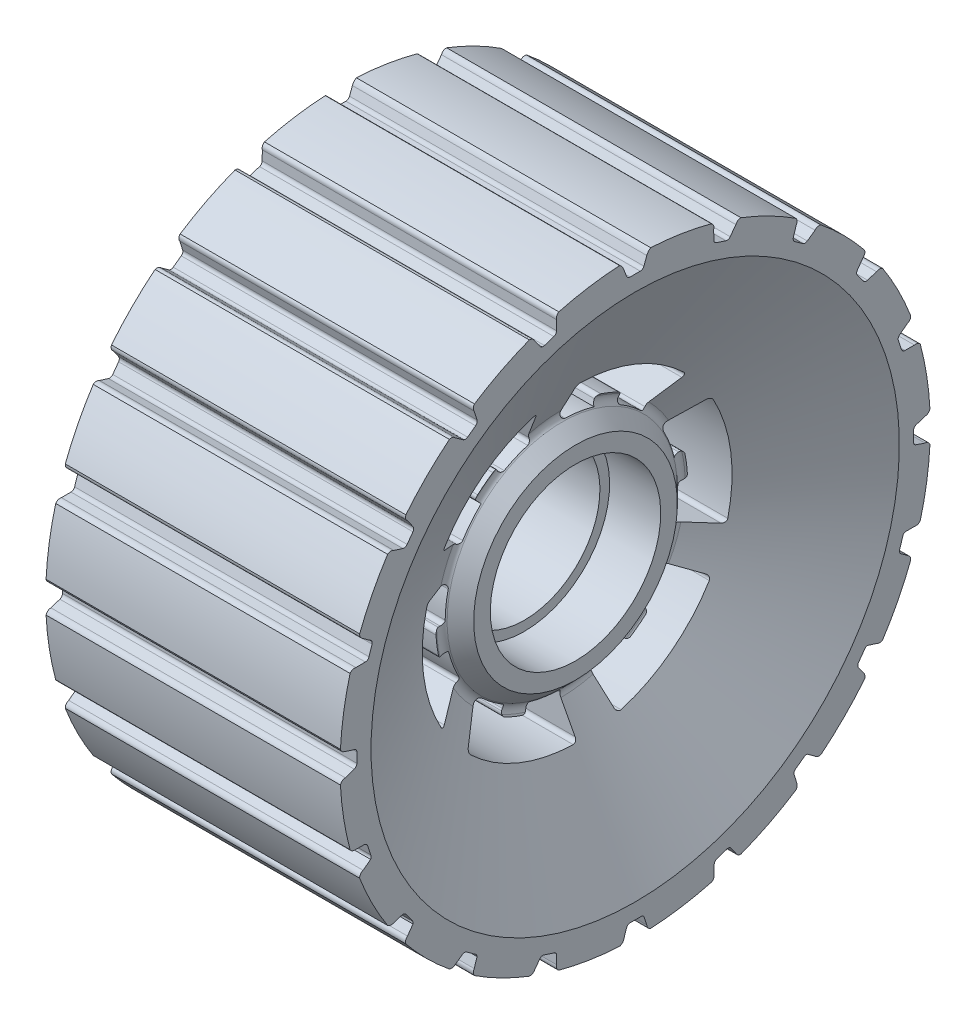
from build123d import *

# Parameters (mm, degrees)
CUT_EXTRUDE1_DEPTH = 25
FILLET2_R          = 0.5
CIRPATTERN1_START  = -11.507760495
CIRPATTERN1_DEPTH  = 23.015520709
FILLET3_R          = 0.5
CUT_EXTRUDE3_DEPTH = 66.933451355


# Read off the part's stored shape, not the designer's step: CirPattern1
with BuildPart() as part:
    # Sketch3 → revolveHub (revolve)
    with BuildSketch(Plane.XY, mode=Mode.PRIVATE) as revolvehub_sk:
        with BuildLine():
            Line((-11.3, 11), (-4.7, 11))
            Line((-4.7, 11), (-4.7, 9.75))
            Line((-4.7, 9.75), (4.7, 9.75))
            Line((4.7, 9.75), (4.7, 11))
            Line((4.7, 11), (11.3, 11))
            Line((11.3, 11), (11.3, 13.15))
            Line((11.3, 13.15), (9.581889198, 14.868110802))
            ThreePointArc((9.581889198, 14.868110802), (9.3, 15.427275186), (9.405922165, 16.04445168))
            Line((9.405922165, 16.04445168), (19, 34.1))
            Line((19, 34.1), (19, 38.1))
            Line((19, 38.1), (-19, 38.1))
            Line((-19, 38.1), (-19, 34.1))
            Line((-19, 34.1), (-9.405922165, 16.04445168))
            ThreePointArc((-9.405922165, 16.04445168), (-9.3, 15.427275186), (-9.581889198, 14.868110802))
            Line((-9.581889198, 14.868110802), (-11.3, 13.15))
            Line((-11.3, 13.15), (-11.3, 11))
        make_face()
    revolve(revolvehub_sk.sketch.rotate(Axis((0, 0, 0), (1, 0, 0)), 180), axis=Axis((0, 0, 0), (1, 0, 0)))

    # Sketch6 → Cut-Extrude1 (cut, symmetric)
    with BuildSketch(Plane(origin=(0, 0, 0), x_dir=(0, 0, -1), z_dir=(1, 0, 0))):
        with BuildLine():
            Line((0, 15), (0, 20))
            ThreePointArc((0, 20), (7.653668647, 18.47759065), (14.142135624, 14.142135624))
            Line((14.142135624, 14.142135624), (10.606601718, 10.606601718))
            ThreePointArc((10.606601718, 10.606601718), (8.993978418, 12.004513826), (7.199288528, 13.159416579))
            Line((7.199288528, 13.159416579), (7.799229239, 14.256034627))
            ThreePointArc((7.799229239, 14.256034627), (6.218605776, 15.013042403), (4.565650875, 15.59542664))
            Line((4.565650875, 15.59542664), (4.214446961, 14.395778437))
            ThreePointArc((4.214446961, 14.395778437), (2.128770002, 14.848176261), (0, 15))
        make_face()
    extrude(amount=CUT_EXTRUDE1_DEPTH, both=True, mode=Mode.SUBTRACT)

    # Fillet2
    fillet2_edges = [part.edges().sort_by_distance(p)[0] for p in [
        (0, 15, 0),
        (0, 10.606601718, -10.606601718),
        (0, 13.159416579, -7.199288528),
        (0, 14.256034627, -7.799229239),
        (0, 15.59542664, -4.565650875),
        (0, 14.142135624, -14.142135624),
        (0, 20, 0),
    ]]
    fillet(fillet2_edges, radius=FILLET2_R)

    # CirPattern1 outline → CirPattern1 (cut)
    with BuildSketch(Plane.YZ.offset(CIRPATTERN1_START)):
        with BuildLine():
            ThreePointArc((-5.04531201, -18.829360762), (-4.992120814, -19.214301636), (-4.679332407, -19.4448926))
            ThreePointArc((-4.679332407, -19.4448926), (2.610523845, -19.828897227), (9.552596557, -17.571223606))
            ThreePointArc((9.552596557, -17.571223606), (9.795045624, -17.267534242), (9.746794345, -16.881943016))
            Line((9.746794345, -16.881943016), (7.745966692, -13.416407865))
            ThreePointArc((7.745966692, -13.416407865), (7.450137413, -13.185595315), (7.077052249, -13.225555998))
            ThreePointArc((7.077052249, -13.225555998), (5.355194818, -14.0114913), (3.548071087, -14.574333314))
            Line((3.548071087, -14.574333314), (3.723596882, -15.295336749))
            ThreePointArc((3.723596882, -15.295336749), (3.66075533, -15.680245528), (3.340572621, -15.902926604))
            ThreePointArc((3.340572621, -15.902926604), (2.121050623, -16.110978997), (0.889234908, -16.225651336))
            ThreePointArc((0.889234908, -16.225651336), (0.522328057, -16.093427317), (0.362006057, -15.737898577))
            Line((0.362006057, -15.737898577), (0.356254085, -15.487836615))
            ThreePointArc((0.356254085, -15.487836615), (0.20750378, -15.143362026), (-0.138980992, -14.999356129))
            ThreePointArc((-0.138980992, -14.999356129), (-1.786756878, -14.893203143), (-3.412881767, -14.606582011))
            ThreePointArc((-3.412881767, -14.606582011), (-3.783596948, -14.664544501), (-4.009607405, -14.964058556))
            Line((-4.009607405, -14.964058556), (-5.04531201, -18.829360762))
        make_face()
        with BuildLine():
            ThreePointArc((18.829360762, 5.04531201), (19.13613374, 5.283847374), (19.179437169, 5.670025562))
            ThreePointArc((19.179437169, 5.670025562), (15.867066806, 12.17522858), (10.44082774, 17.058403093))
            ThreePointArc((10.44082774, 17.058403093), (10.056600503, 17.116525463), (9.746794345, 16.881943016))
            Line((9.746794345, 16.881943016), (7.745966692, 13.416407865))
            ThreePointArc((7.745966692, 13.416407865), (7.6939918, 13.044805919), (7.915141349, 12.741685031))
            ThreePointArc((7.915141349, 12.741685031), (9.456710002, 11.643480405), (10.84770735, 10.359886353))
            Line((10.84770735, 10.359886353), (11.384351743, 10.872397868))
            ThreePointArc((11.384351743, 10.872397868), (11.7491133, 11.010429877), (12.102052123, 10.844484055))
            ThreePointArc((12.102052123, 10.844484055), (12.89199178, 9.892373221), (13.607208796, 8.882925689))
            ThreePointArc((13.607208796, 8.882925689), (13.676152862, 8.499063025), (13.448416941, 8.18245573))
            Line((13.448416941, 8.18245573), (13.234732916, 8.052443396))
            ThreePointArc((13.234732916, 8.052443396), (13.010784323, 7.751384558), (13.059313944, 7.379316995))
            ThreePointArc((13.059313944, 7.379316995), (13.791270705, 5.899224725), (14.356111967, 4.347648695))
            ThreePointArc((14.356111967, 4.347648695), (14.591666546, 4.055581175), (14.964058556, 4.009607405))
            Line((14.964058556, 4.009607405), (18.829360762, 5.04531201))
        make_face()
        with BuildLine():
            ThreePointArc((5.04531201, 18.829360762), (4.992120814, 19.214301636), (4.679332407, 19.4448926))
            ThreePointArc((4.679332407, 19.4448926), (-2.610523845, 19.828897227), (-9.552596557, 17.571223606))
            ThreePointArc((-9.552596557, 17.571223606), (-9.795045624, 17.267534242), (-9.746794345, 16.881943016))
            Line((-9.746794345, 16.881943016), (-7.745966692, 13.416407865))
            ThreePointArc((-7.745966692, 13.416407865), (-7.450137413, 13.185595315), (-7.077052249, 13.225555998))
            ThreePointArc((-7.077052249, 13.225555998), (-5.355194818, 14.0114913), (-3.548071087, 14.574333314))
            Line((-3.548071087, 14.574333314), (-3.723596882, 15.295336749))
            ThreePointArc((-3.723596882, 15.295336749), (-3.66075533, 15.680245528), (-3.340572621, 15.902926604))
            ThreePointArc((-3.340572621, 15.902926604), (-2.121050623, 16.110978997), (-0.889234908, 16.225651336))
            ThreePointArc((-0.889234908, 16.225651336), (-0.522328057, 16.093427317), (-0.362006057, 15.737898577))
            Line((-0.362006057, 15.737898577), (-0.356254085, 15.487836615))
            ThreePointArc((-0.356254085, 15.487836615), (-0.20750378, 15.143362026), (0.138980992, 14.999356129))
            ThreePointArc((0.138980992, 14.999356129), (1.786756878, 14.893203143), (3.412881767, 14.606582011))
            ThreePointArc((3.412881767, 14.606582011), (3.783596948, 14.664544501), (4.009607405, 14.964058556))
            Line((4.009607405, 14.964058556), (5.04531201, 18.829360762))
        make_face()
        with BuildLine():
            ThreePointArc((-13.784048752, 13.784048752), (-14.144012926, 13.930454262), (-14.500104762, 13.774867037))
            ThreePointArc((-14.500104762, 13.774867037), (-18.47759065, 7.653668647), (-19.993424297, 0.512820513))
            ThreePointArc((-19.993424297, 0.512820513), (-19.851646127, 0.15100878), (-19.49358869, 0))
            Line((-19.49358869, 0), (-15.491933385, 0))
            ThreePointArc((-15.491933385, 0), (-15.144129213, 0.140789396), (-14.992193598, 0.483870968))
            ThreePointArc((-14.992193598, 0.483870968), (-14.81190482, 2.368010896), (-14.395778437, 4.214446961))
            Line((-14.395778437, 4.214446961), (-15.107948625, 4.422938881))
            ThreePointArc((-15.107948625, 4.422938881), (-15.40986863, 4.669815651), (-15.442624744, 5.058442549))
            ThreePointArc((-15.442624744, 5.058442549), (-15.013042403, 6.218605776), (-14.496443704, 7.342725647))
            ThreePointArc((-14.496443704, 7.342725647), (-14.198480919, 7.594364292), (-13.810422998, 7.555442847))
            Line((-13.810422998, 7.555442847), (-13.590987001, 7.43539322))
            ThreePointArc((-13.590987001, 7.43539322), (-13.218288103, 7.391977468), (-12.920332952, 7.620039134))
            ThreePointArc((-12.920332952, 7.620039134), (-12.004513826, 8.993978418), (-10.943230201, 10.258933316))
            ThreePointArc((-10.943230201, 10.258933316), (-10.808069598, 10.608963325), (-10.95445115, 10.95445115))
            Line((-10.95445115, 10.95445115), (-13.784048752, 13.784048752))
        make_face()
        with BuildLine():
            ThreePointArc((-18.829360762, -5.04531201), (-19.13613374, -5.283847374), (-19.179437169, -5.670025562))
            ThreePointArc((-19.179437169, -5.670025562), (-15.867066806, -12.17522858), (-10.44082774, -17.058403093))
            ThreePointArc((-10.44082774, -17.058403093), (-10.056600503, -17.116525463), (-9.746794345, -16.881943016))
            Line((-9.746794345, -16.881943016), (-7.745966692, -13.416407865))
            ThreePointArc((-7.745966692, -13.416407865), (-7.6939918, -13.044805919), (-7.915141349, -12.741685031))
            ThreePointArc((-7.915141349, -12.741685031), (-9.456710002, -11.643480405), (-10.84770735, -10.359886353))
            Line((-10.84770735, -10.359886353), (-11.384351743, -10.872397868))
            ThreePointArc((-11.384351743, -10.872397868), (-11.7491133, -11.010429877), (-12.102052123, -10.844484055))
            ThreePointArc((-12.102052123, -10.844484055), (-12.89199178, -9.892373221), (-13.607208796, -8.882925689))
            ThreePointArc((-13.607208796, -8.882925689), (-13.676152862, -8.499063025), (-13.448416941, -8.18245573))
            Line((-13.448416941, -8.18245573), (-13.234732916, -8.052443396))
            ThreePointArc((-13.234732916, -8.052443396), (-13.010784323, -7.751384558), (-13.059313944, -7.379316995))
            ThreePointArc((-13.059313944, -7.379316995), (-13.791270705, -5.899224725), (-14.356111967, -4.347648695))
            ThreePointArc((-14.356111967, -4.347648695), (-14.591666546, -4.055581175), (-14.964058556, -4.009607405))
            Line((-14.964058556, -4.009607405), (-18.829360762, -5.04531201))
        make_face()
    extrude(amount=CIRPATTERN1_DEPTH, mode=Mode.SUBTRACT)

    # Fillet3
    fillet3_edges = [part.edges().sort_by_distance(p)[0] for p in [
        (-11.3, 11, 0),
    ]]
    fillet(fillet3_edges, radius=FILLET3_R)

    # Sketch8 → Cut-Extrude3 (cut, through all)
    with BuildSketch(Plane(origin=(19, 0, 0), x_dir=(0, 0, -1), z_dir=(1, 0, 0))):
        with BuildLine():
            Line((-1.12214797, 36.423269324), (-1.5, 37.423269324))
            ThreePointArc((-1.5, 37.423269324), (-1.700578209, 37.774957877), (-2, 38.04747035))
            ThreePointArc((-2, 38.04747035), (0, 38.1), (2, 38.04747035))
            ThreePointArc((2, 38.04747035), (1.700578209, 37.774957877), (1.5, 37.423269324))
            Line((1.5, 37.423269324), (1.12214797, 36.423269324))
            ThreePointArc((1.12214797, 36.423269324), (0.938707297, 36.188681791), (0.654423406, 36.1))
            Line((0.654423406, 36.1), (-0.654423406, 36.1))
            ThreePointArc((-0.654423406, 36.1), (-0.938707297, 36.188681791), (-1.12214797, 36.423269324))
        make_face()
        with BuildLine():
            Line((10.147108479, 34.834445598), (10.137841432, 36.055169643))
            ThreePointArc((10.137841432, 36.055169643), (10.118952397, 36.475501008), (9.855201898, 36.803328593))
            ThreePointArc((9.855201898, 36.803328593), (11.773547486, 36.235253271), (13.659427964, 35.567260616))
            ThreePointArc((13.659427964, 35.567260616), (13.253357108, 35.457071181), (12.991010981, 35.12811866))
            Line((12.991010981, 35.12811866), (12.265990191, 34.145979195))
            ThreePointArc((12.265990191, 34.145979195), (12.016426804, 33.966822774), (11.709215854, 33.967405807))
            Line((11.709215854, 33.967405807), (10.492585575, 34.362712948))
            ThreePointArc((10.492585575, 34.362712948), (10.243703998, 34.54281533), (10.147108479, 34.834445598))
        make_face()
        with BuildLine():
            Line((20.41490932, 29.993897514), (20.78332031, 31.157738747))
            ThreePointArc((20.78332031, 31.157738747), (20.895245305, 31.563334662), (20.74570797, 31.95662061))
            ThreePointArc((20.74570797, 31.95662061), (22.394618112, 30.823547486), (23.981775947, 29.605479601))
            ThreePointArc((23.981775947, 29.605479601), (23.561529206, 29.626166017), (23.210371293, 29.39438299))
            Line((23.210371293, 29.39438299), (22.217337761, 28.684356597))
            ThreePointArc((22.217337761, 28.684356597), (21.924626497, 28.591088043), (21.632631688, 28.686575944))
            Line((21.632631688, 28.686575944), (20.597704157, 29.438494809))
            ThreePointArc((20.597704157, 29.438494809), (20.416658409, 29.68669099), (20.41490932, 29.993897514))
        make_face()
        with BuildLine():
            Line((28.684356597, 22.217337761), (29.39438299, 23.210371293))
            ThreePointArc((29.39438299, 23.210371293), (29.626166017, 23.561529206), (29.605479601, 23.981775947))
            ThreePointArc((29.605479601, 23.981775947), (30.823547486, 22.394618112), (31.95662061, 20.74570797))
            ThreePointArc((31.95662061, 20.74570797), (31.563334662, 20.895245305), (31.157738747, 20.78332031))
            Line((31.157738747, 20.78332031), (29.993897514, 20.41490932))
            ThreePointArc((29.993897514, 20.41490932), (29.68669099, 20.416658409), (29.438494809, 20.597704157))
            Line((29.438494809, 20.597704157), (28.686575944, 21.632631688))
            ThreePointArc((28.686575944, 21.632631688), (28.591088043, 21.924626497), (28.684356597, 22.217337761))
        make_face()
        with BuildLine():
            Line((34.145979195, 12.265990191), (35.12811866, 12.991010981))
            ThreePointArc((35.12811866, 12.991010981), (35.457071181, 13.253357108), (35.567260616, 13.659427964))
            ThreePointArc((35.567260616, 13.659427964), (36.235253271, 11.773547486), (36.803328593, 9.855201898))
            ThreePointArc((36.803328593, 9.855201898), (36.475501008, 10.118952397), (36.055169643, 10.137841432))
            Line((36.055169643, 10.137841432), (34.834445598, 10.147108479))
            ThreePointArc((34.834445598, 10.147108479), (34.54281533, 10.243703998), (34.362712948, 10.492585575))
            Line((34.362712948, 10.492585575), (33.967405807, 11.709215854))
            ThreePointArc((33.967405807, 11.709215854), (33.966822774, 12.016426804), (34.145979195, 12.265990191))
        make_face()
        with BuildLine():
            Line((36.265155441, 1.113962039), (37.423269324, 1.5))
            ThreePointArc((37.423269324, 1.5), (37.817191174, 1.647854074), (38.04747035, 2))
            ThreePointArc((38.04747035, 2), (38.1, 0), (38.04747035, -2))
            ThreePointArc((38.04747035, -2), (37.817191174, -1.647854074), (37.423269324, -1.5))
            Line((37.423269324, -1.5), (36.265155441, -1.113962039))
            ThreePointArc((36.265155441, -1.113962039), (36.017648231, -0.931975532), (35.923269324, -0.63962039))
            Line((35.923269324, -0.63962039), (35.923269324, 0.63962039))
            ThreePointArc((35.923269324, 0.63962039), (36.017648231, 0.931975532), (36.265155441, 1.113962039))
        make_face()
        with BuildLine():
            Line((34.834445598, -10.147108479), (36.055169643, -10.137841432))
            ThreePointArc((36.055169643, -10.137841432), (36.475501008, -10.118952397), (36.803328593, -9.855201898))
            ThreePointArc((36.803328593, -9.855201898), (36.235253271, -11.773547486), (35.567260616, -13.659427964))
            ThreePointArc((35.567260616, -13.659427964), (35.513213755, -13.316541982), (35.296199521, -13.045623763))
            Line((35.296199521, -13.045623763), (34.314060057, -12.320602973))
            ThreePointArc((34.314060057, -12.320602973), (34.134903635, -12.071039586), (34.135486668, -11.763828637))
            Line((34.135486668, -11.763828637), (34.530793809, -10.547198357))
            ThreePointArc((34.530793809, -10.547198357), (34.628736368, -10.306258179), (34.834445598, -10.147108479))
        make_face()
        with BuildLine():
            Line((29.993897514, -20.41490932), (31.157738747, -20.78332031))
            ThreePointArc((31.157738747, -20.78332031), (31.563334662, -20.895245305), (31.95662061, -20.74570797))
            ThreePointArc((31.95662061, -20.74570797), (30.823547486, -22.394618112), (29.605479601, -23.981775947))
            ThreePointArc((29.605479601, -23.981775947), (29.660035578, -23.638970602), (29.53736111, -23.314250978))
            Line((29.53736111, -23.314250978), (28.827334718, -22.321217446))
            ThreePointArc((28.827334718, -22.321217446), (28.734066164, -22.028506182), (28.829554065, -21.736511373))
            Line((28.829554065, -21.736511373), (29.581472929, -20.701583842))
            ThreePointArc((29.581472929, -20.701583842), (29.749076448, -20.502702031), (29.993897514, -20.41490932))
        make_face()
        with BuildLine():
            Line((22.217337761, -28.684356597), (23.210371293, -29.39438299))
            ThreePointArc((23.210371293, -29.39438299), (23.561529206, -29.626166017), (23.981775947, -29.605479601))
            ThreePointArc((23.981775947, -29.605479601), (22.394618112, -30.823547486), (20.74570797, -31.95662061))
            ThreePointArc((20.74570797, -31.95662061), (20.903526464, -31.647452077), (20.887199995, -31.300716867))
            Line((20.887199995, -31.300716867), (20.518789005, -30.136875634))
            ThreePointArc((20.518789005, -30.136875634), (20.520538094, -29.82966911), (20.701583842, -29.581472929))
            Line((20.701583842, -29.581472929), (21.736511373, -28.829554065))
            ThreePointArc((21.736511373, -28.829554065), (21.957369651, -28.692198557), (22.217337761, -28.684356597))
        make_face()
        with BuildLine():
            Line((12.265990191, -34.145979195), (12.991010981, -35.12811866))
            ThreePointArc((12.991010981, -35.12811866), (13.253357108, -35.457071181), (13.659427964, -35.567260616))
            ThreePointArc((13.659427964, -35.567260616), (11.773547486, -36.235253271), (9.855201898, -36.803328593))
            ThreePointArc((9.855201898, -36.803328593), (10.100834537, -36.558060442), (10.192454214, -36.223250504))
            Line((10.192454214, -36.223250504), (10.201721261, -35.002526459))
            ThreePointArc((10.201721261, -35.002526459), (10.29831678, -34.710896191), (10.547198357, -34.530793809))
            Line((10.547198357, -34.530793809), (11.763828637, -34.135486668))
            ThreePointArc((11.763828637, -34.135486668), (12.016322527, -34.073102779), (12.265990191, -34.145979195))
        make_face()
        with BuildLine():
            Line((1.113962039, -36.265155441), (1.5, -37.423269324))
            ThreePointArc((1.5, -37.423269324), (1.647854074, -37.817191174), (2, -38.04747035))
            ThreePointArc((2, -38.04747035), (0, -38.1), (-2, -38.04747035))
            ThreePointArc((-2, -38.04747035), (-1.690597451, -37.890111135), (-1.5, -37.6))
            Line((-1.5, -37.6), (-1.113962039, -36.441886117))
            ThreePointArc((-1.113962039, -36.441886117), (-0.931975532, -36.194378907), (-0.63962039, -36.1))
            Line((-0.63962039, -36.1), (0.63962039, -36.1))
            ThreePointArc((0.63962039, -36.1), (0.899034032, -36.118694299), (1.113962039, -36.265155441))
        make_face()
        with BuildLine():
            Line((-10.147108479, -34.834445598), (-10.137841432, -36.055169643))
            ThreePointArc((-10.137841432, -36.055169643), (-10.118952397, -36.475501008), (-9.855201898, -36.803328593))
            ThreePointArc((-9.855201898, -36.803328593), (-11.773547486, -36.235253271), (-13.659427964, -35.567260616))
            ThreePointArc((-13.659427964, -35.567260616), (-13.316541982, -35.513213755), (-13.045623763, -35.296199521))
            Line((-13.045623763, -35.296199521), (-12.320602973, -34.314060057))
            ThreePointArc((-12.320602973, -34.314060057), (-12.071039586, -34.134903635), (-11.763828637, -34.135486668))
            Line((-11.763828637, -34.135486668), (-10.547198357, -34.530793809))
            ThreePointArc((-10.547198357, -34.530793809), (-10.306258179, -34.628736368), (-10.147108479, -34.834445598))
        make_face()
        with BuildLine():
            Line((-20.41490932, -29.993897514), (-20.78332031, -31.157738747))
            ThreePointArc((-20.78332031, -31.157738747), (-20.895245305, -31.563334662), (-20.74570797, -31.95662061))
            ThreePointArc((-20.74570797, -31.95662061), (-22.394618112, -30.823547486), (-23.981775947, -29.605479601))
            ThreePointArc((-23.981775947, -29.605479601), (-23.638970602, -29.660035578), (-23.314250978, -29.53736111))
            Line((-23.314250978, -29.53736111), (-22.321217446, -28.827334718))
            ThreePointArc((-22.321217446, -28.827334718), (-22.028506182, -28.734066164), (-21.736511373, -28.829554065))
            Line((-21.736511373, -28.829554065), (-20.701583842, -29.581472929))
            ThreePointArc((-20.701583842, -29.581472929), (-20.502702031, -29.749076448), (-20.41490932, -29.993897514))
        make_face()
        with BuildLine():
            Line((-28.684356597, -22.217337761), (-29.39438299, -23.210371293))
            ThreePointArc((-29.39438299, -23.210371293), (-29.626166017, -23.561529206), (-29.605479601, -23.981775947))
            ThreePointArc((-29.605479601, -23.981775947), (-30.823547486, -22.394618112), (-31.95662061, -20.74570797))
            ThreePointArc((-31.95662061, -20.74570797), (-31.647452077, -20.903526464), (-31.300716867, -20.887199995))
            Line((-31.300716867, -20.887199995), (-30.136875634, -20.518789005))
            ThreePointArc((-30.136875634, -20.518789005), (-29.82966911, -20.520538094), (-29.581472929, -20.701583842))
            Line((-29.581472929, -20.701583842), (-28.829554065, -21.736511373))
            ThreePointArc((-28.829554065, -21.736511373), (-28.692198557, -21.957369651), (-28.684356597, -22.217337761))
        make_face()
        with BuildLine():
            Line((-34.145979195, -12.265990191), (-35.12811866, -12.991010981))
            ThreePointArc((-35.12811866, -12.991010981), (-35.457071181, -13.253357108), (-35.567260616, -13.659427964))
            ThreePointArc((-35.567260616, -13.659427964), (-36.235253271, -11.773547486), (-36.803328593, -9.855201898))
            ThreePointArc((-36.803328593, -9.855201898), (-36.558060442, -10.100834537), (-36.223250504, -10.192454214))
            Line((-36.223250504, -10.192454214), (-35.002526459, -10.201721261))
            ThreePointArc((-35.002526459, -10.201721261), (-34.710896191, -10.29831678), (-34.530793809, -10.547198357))
            Line((-34.530793809, -10.547198357), (-34.135486668, -11.763828637))
            ThreePointArc((-34.135486668, -11.763828637), (-34.073102779, -12.016322527), (-34.145979195, -12.265990191))
        make_face()
        with BuildLine():
            Line((-36.265155441, -1.113962039), (-37.423269324, -1.5))
            ThreePointArc((-37.423269324, -1.5), (-37.817191174, -1.647854074), (-38.04747035, -2))
            ThreePointArc((-38.04747035, -2), (-38.1, 0), (-38.04747035, 2))
            ThreePointArc((-38.04747035, 2), (-37.890111135, 1.690597451), (-37.6, 1.5))
            Line((-37.6, 1.5), (-36.441886117, 1.113962039))
            ThreePointArc((-36.441886117, 1.113962039), (-36.085176001, 0.98328443), (-35.923269324, 0.63962039))
            Line((-35.923269324, 0.63962039), (-35.923269324, -0.63962039))
            ThreePointArc((-35.923269324, -0.63962039), (-36.017648231, -0.931975532), (-36.265155441, -1.113962039))
        make_face()
        with BuildLine():
            Line((-34.834445598, 10.147108479), (-36.055169643, 10.137841432))
            ThreePointArc((-36.055169643, 10.137841432), (-36.475501008, 10.118952397), (-36.803328593, 9.855201898))
            ThreePointArc((-36.803328593, 9.855201898), (-36.235253271, 11.773547486), (-35.567260616, 13.659427964))
            ThreePointArc((-35.567260616, 13.659427964), (-35.513213755, 13.316541982), (-35.296199521, 13.045623763))
            Line((-35.296199521, 13.045623763), (-34.314060057, 12.320602973))
            ThreePointArc((-34.314060057, 12.320602973), (-34.015190178, 12.086091694), (-33.967405807, 11.709215854))
            Line((-33.967405807, 11.709215854), (-34.362712948, 10.492585575))
            ThreePointArc((-34.362712948, 10.492585575), (-34.54281533, 10.243703998), (-34.834445598, 10.147108479))
        make_face()
        with BuildLine():
            Line((-29.993897514, 20.41490932), (-31.157738747, 20.78332031))
            ThreePointArc((-31.157738747, 20.78332031), (-31.563334662, 20.895245305), (-31.95662061, 20.74570797))
            ThreePointArc((-31.95662061, 20.74570797), (-30.823547486, 22.394618112), (-29.605479601, 23.981775947))
            ThreePointArc((-29.605479601, 23.981775947), (-29.626166017, 23.561529206), (-29.39438299, 23.210371293))
            Line((-29.39438299, 23.210371293), (-28.684356597, 22.217337761))
            ThreePointArc((-28.684356597, 22.217337761), (-28.591088043, 21.924626497), (-28.686575944, 21.632631688))
            Line((-28.686575944, 21.632631688), (-29.438494809, 20.597704157))
            ThreePointArc((-29.438494809, 20.597704157), (-29.68669099, 20.416658409), (-29.993897514, 20.41490932))
        make_face()
        with BuildLine():
            Line((-22.217337761, 28.684356597), (-23.210371293, 29.39438299))
            ThreePointArc((-23.210371293, 29.39438299), (-23.561529206, 29.626166017), (-23.981775947, 29.605479601))
            ThreePointArc((-23.981775947, 29.605479601), (-22.394618112, 30.823547486), (-20.74570797, 31.95662061))
            ThreePointArc((-20.74570797, 31.95662061), (-20.895245305, 31.563334662), (-20.78332031, 31.157738747))
            Line((-20.78332031, 31.157738747), (-20.41490932, 29.993897514))
            ThreePointArc((-20.41490932, 29.993897514), (-20.416658409, 29.68669099), (-20.597704157, 29.438494809))
            Line((-20.597704157, 29.438494809), (-21.632631688, 28.686575944))
            ThreePointArc((-21.632631688, 28.686575944), (-21.924626497, 28.591088043), (-22.217337761, 28.684356597))
        make_face()
        with BuildLine():
            Line((-12.265990191, 34.145979195), (-12.991010981, 35.12811866))
            ThreePointArc((-12.991010981, 35.12811866), (-13.253357108, 35.457071181), (-13.659427964, 35.567260616))
            ThreePointArc((-13.659427964, 35.567260616), (-11.773547486, 36.235253271), (-9.855201898, 36.803328593))
            ThreePointArc((-9.855201898, 36.803328593), (-10.118952397, 36.475501008), (-10.137841432, 36.055169643))
            Line((-10.137841432, 36.055169643), (-10.147108479, 34.834445598))
            ThreePointArc((-10.147108479, 34.834445598), (-10.243703998, 34.54281533), (-10.492585575, 34.362712948))
            Line((-10.492585575, 34.362712948), (-11.709215854, 33.967405807))
            ThreePointArc((-11.709215854, 33.967405807), (-12.016426804, 33.966822774), (-12.265990191, 34.145979195))
        make_face()
    extrude(amount=-CUT_EXTRUDE3_DEPTH, mode=Mode.SUBTRACT)


solid = part.part
